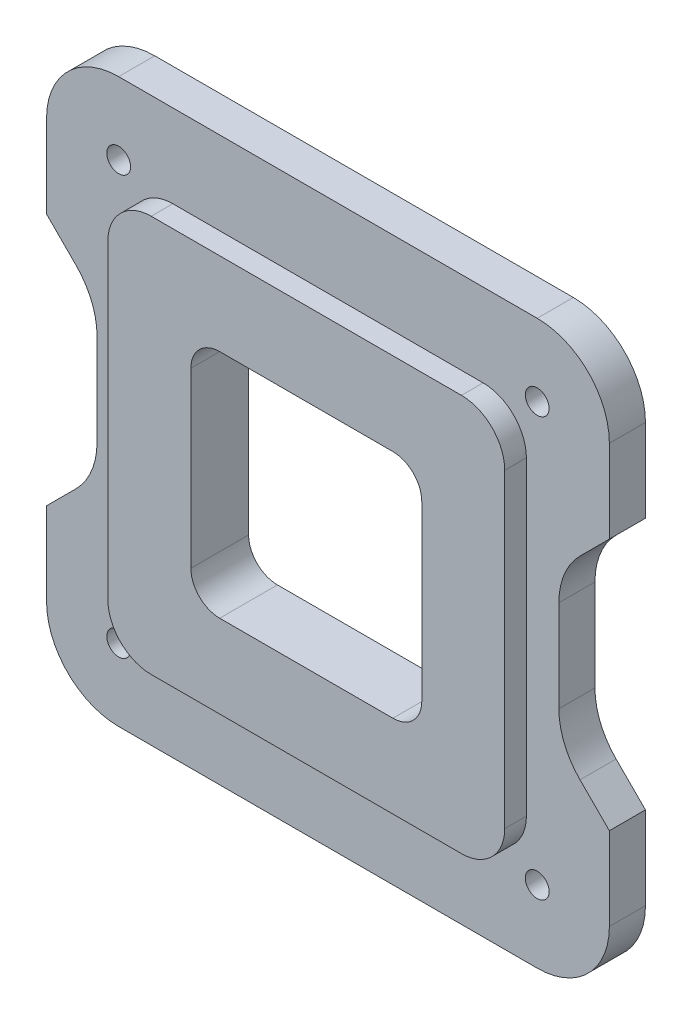
from build123d import *

# Parameters (mm, degrees)
BOSS_EXTRUDE1_DEPTH         = 5
BOSS_EXTRUDE2_DEPTH         = 3
CUT_EXTRUDE1_DEPTH          = 56.731499172
CUT_EXTRUDE1_DEPTH_BACK     = 56.731499172
TAP_DRILL_FOR_M4_TAP1_D     = 3.3
TAP_DRILL_FOR_M4_TAP1_DEPTH = 10
TAP_DRILL_FOR_M4_TAP1_TIP   = 0.991420021


with BuildPart() as part:
    # Sketch1 → Boss-Extrude1 (new body)
    with BuildSketch(Plane.XY):
        with BuildLine():
            Line((-29, 39), (29, 39))
            ThreePointArc((29, 39), (36.071067812, 36.071067812), (39, 29))
            Line((39, 29), (39, 17.5))
            Line((39, 17.5), (34.928932188, 13.428932188))
            ThreePointArc((34.928932188, 13.428932188), (32.761204675, 10.1846987), (32, 6.357864376))
            Line((32, 6.357864376), (32, -6.357864376))
            ThreePointArc((32, -6.357864376), (32.761204675, -10.1846987), (34.928932188, -13.428932188))
            Line((34.928932188, -13.428932188), (39, -17.5))
            Line((39, -17.5), (39, -29))
            ThreePointArc((39, -29), (36.071067812, -36.071067812), (29, -39))
            Line((29, -39), (-29, -39))
            ThreePointArc((-29, -39), (-36.071067812, -36.071067812), (-39, -29))
            Line((-39, -29), (-39, -17.5))
            Line((-39, -17.5), (-34.928932188, -13.428932188))
            ThreePointArc((-34.928932188, -13.428932188), (-32.761204675, -10.1846987), (-32, -6.357864376))
            Line((-32, -6.357864376), (-32, 6.357864376))
            ThreePointArc((-32, 6.357864376), (-32.761204675, 10.1846987), (-34.928932188, 13.428932188))
            Line((-34.928932188, 13.428932188), (-39, 17.5))
            Line((-39, 17.5), (-39, 29))
            ThreePointArc((-39, 29), (-36.071067812, 36.071067812), (-29, 39))
        make_face()
    extrude(amount=BOSS_EXTRUDE1_DEPTH)

    # Sketch2 → Boss-Extrude2 (add)
    with BuildSketch(Plane(origin=(0, 0, 5), x_dir=(-1, 0, 0), z_dir=(0, 0, -1))):
        with BuildLine():
            Line((-21.5, 27.5), (21.5, 27.5))
            ThreePointArc((21.5, 27.5), (25.742640687, 25.742640687), (27.5, 21.5))
            Line((27.5, 21.5), (27.5, -21.5))
            ThreePointArc((27.5, -21.5), (25.742640687, -25.742640687), (21.5, -27.5))
            Line((21.5, -27.5), (-21.5, -27.5))
            ThreePointArc((-21.5, -27.5), (-25.742640687, -25.742640687), (-27.5, -21.5))
            Line((-27.5, -21.5), (-27.5, 21.5))
            ThreePointArc((-27.5, 21.5), (-25.742640687, 25.742640687), (-21.5, 27.5))
        make_face()
    extrude(amount=-BOSS_EXTRUDE2_DEPTH)

    # Sketch3 → Cut-Extrude1 (cut, two sides: drawn at the far end of the back side and taken through both)
    with BuildSketch(Plane(origin=(0, 0, 0), x_dir=(-1, 0, 0), z_dir=(0, 0, -1)).offset(-CUT_EXTRUDE1_DEPTH_BACK)):
        with BuildLine():
            Line((-12, -16), (12, -16))
            ThreePointArc((12, -16), (14.828427125, -14.828427125), (16, -12))
            Line((16, -12), (16, 12))
            ThreePointArc((16, 12), (14.828427125, 14.828427125), (12, 16))
            Line((12, 16), (-12, 16))
            ThreePointArc((-12, 16), (-14.828427125, 14.828427125), (-16, 12))
            Line((-16, 12), (-16, -12))
            ThreePointArc((-16, -12), (-14.828427125, -14.828427125), (-12, -16))
        make_face()
    extrude(amount=CUT_EXTRUDE1_DEPTH + CUT_EXTRUDE1_DEPTH_BACK, mode=Mode.SUBTRACT)

    # Tap Drill for M4 Tap1
    with Locations(Plane(origin=(0, 0, 0), x_dir=(-1, 0, 0), z_dir=(0, 0, -1))):
        with Locations((-29, -29), (29, -29), (29, 29), (-29, 29)):
            Hole(TAP_DRILL_FOR_M4_TAP1_D / 2, depth=TAP_DRILL_FOR_M4_TAP1_DEPTH)
            with Locations((0, 0, -(TAP_DRILL_FOR_M4_TAP1_DEPTH + TAP_DRILL_FOR_M4_TAP1_TIP / 2))):  # 118° drill point
                Cone(0, TAP_DRILL_FOR_M4_TAP1_D / 2, TAP_DRILL_FOR_M4_TAP1_TIP, mode=Mode.SUBTRACT)


solid = part.part
